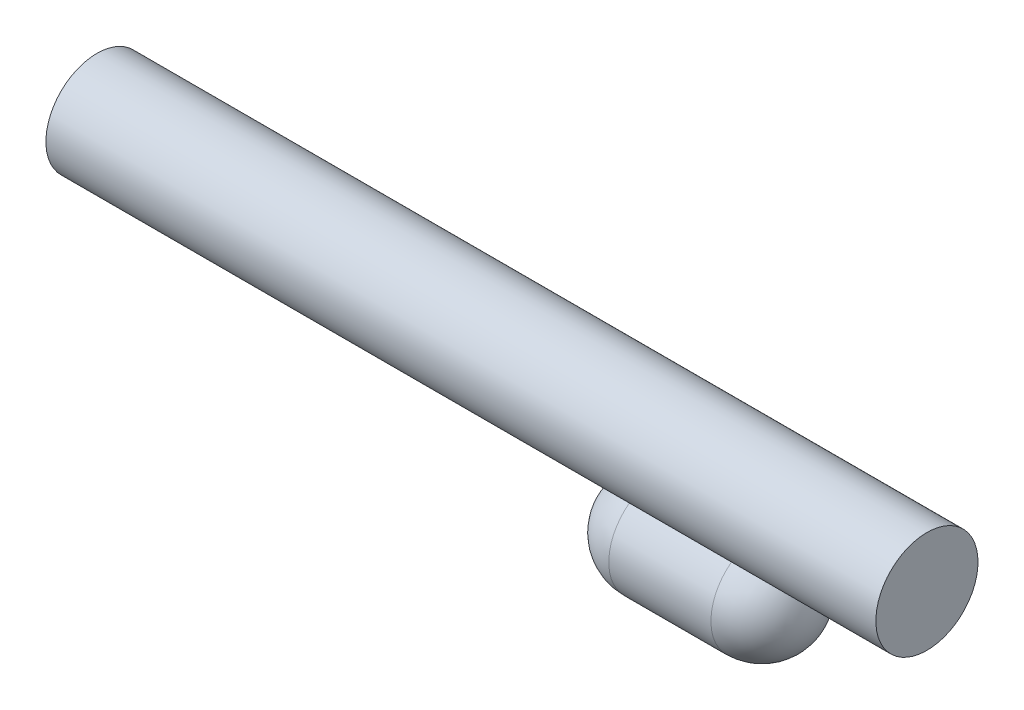
from build123d import *

# Parameters (mm, degrees)
BOSS_EXTRUDE1_DEPTH      = 120.036436628
BOSS_EXTRUDE1_DEPTH_BACK = 123.709790925
SKETCH1_R                = 15
BOSS_EXTRUDE2_DEPTH      = 30
BOSS_EXTRUDE2_DEPTH_BACK = 30
SKETCH2_R                = 15
FILLET3_R                = 15


# Read off the part's stored shape, not the designer's step: Bill Native-20-surface1
with BuildPart() as part:
    # Sketch1 → Boss-Extrude1 (new, two sides: drawn at the far end of the back side and taken through both)
    with BuildSketch(Plane(origin=(0, 0, 0), x_dir=(0, 0, -1), z_dir=(1, 0, 0)).offset(-BOSS_EXTRUDE1_DEPTH_BACK)):
        with Locations((0, -101.489312586)):
            Circle(SKETCH1_R)
    extrude(amount=BOSS_EXTRUDE1_DEPTH + BOSS_EXTRUDE1_DEPTH_BACK)


with BuildPart() as body_2:
    # Sketch2 → Boss-Extrude2 (new, two sides: drawn at the far end of the back side and taken through both)
    with BuildSketch(Plane(origin=(0, 0, 0), x_dir=(0, 0, -1), z_dir=(1, 0, 0)).offset(-BOSS_EXTRUDE2_DEPTH_BACK)):
        with Locations((56.601192843, -182.379747213)):
            Circle(SKETCH2_R)
    extrude(amount=BOSS_EXTRUDE2_DEPTH + BOSS_EXTRUDE2_DEPTH_BACK)

    # Fillet3
    fillet3_edges = [body_2.edges().sort_by_distance(p)[0] for p in [
        (-30, -182.379747213, -41.601192843),
        (30, -182.379747213, -41.601192843),
    ]]
    fillet(fillet3_edges, radius=FILLET3_R)


solid = Compound([part.part, body_2.part])
